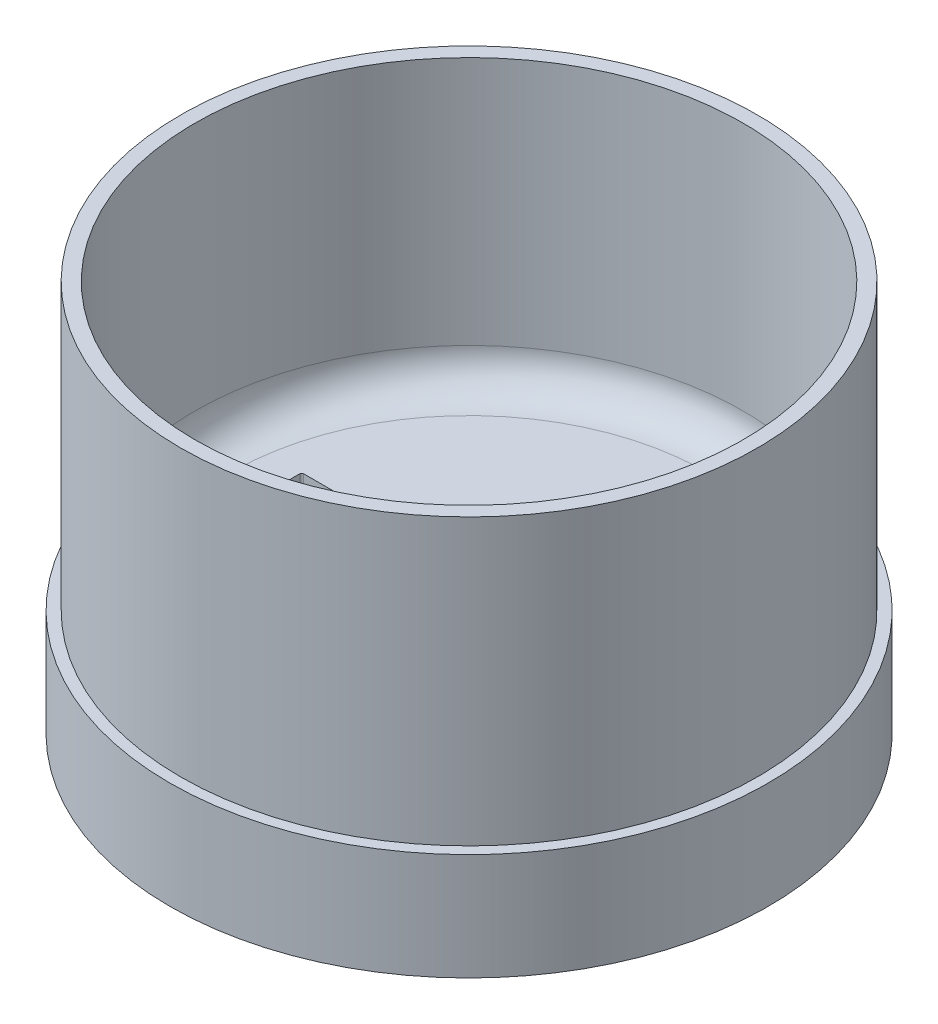
from build123d import *

# Parameters (mm, degrees)
SKETCH1_R           = 84
SKETCH1_R_2         = 79
BOSS_EXTRUDE1_DEPTH = 25
SKETCH2_R           = 84
BOSS_EXTRUDE2_DEPTH = 5
SKETCH3_R           = 81
SKETCH3_R_2         = 77
BOSS_EXTRUDE3_DEPTH = 80
FILLET1_R           = 10
CUT_EXTRUDE1_REACH  = 148.072
SKETCH4_W           = 14
SKETCH4_H           = 7
CUT_EXTRUDE2_REACH  = 145.22
SKETCH5_W           = 14
SKETCH5_H           = 20
FILLET2_R           = 1
FILLET3_R           = 0.5


with BuildPart() as part:
    # Sketch1 → Boss-Extrude1 (new body)
    with BuildSketch(Plane(origin=(0, 0, 0), x_dir=(1, 0, 0), z_dir=(0, 1, 0))):
        Circle(SKETCH1_R)
        Circle(SKETCH1_R_2, mode=Mode.SUBTRACT)
    extrude(amount=BOSS_EXTRUDE1_DEPTH)

    # Sketch2 → Boss-Extrude2 (add)
    with BuildSketch(Plane(origin=(0, 25, 0), x_dir=(1, 0, 0), z_dir=(0, 1, 0))):
        Circle(SKETCH2_R)
    extrude(amount=BOSS_EXTRUDE2_DEPTH)

    # Sketch3 → Boss-Extrude3 (add)
    with BuildSketch(Plane(origin=(0, 30, 0), x_dir=(1, 0, 0), z_dir=(0, 1, 0))):
        Circle(SKETCH3_R)
        Circle(SKETCH3_R_2, mode=Mode.SUBTRACT)
    extrude(amount=BOSS_EXTRUDE3_DEPTH)

    # Fillet1
    fillet1_edges = [part.edges().sort_by_distance(p)[0] for p in [
        (-79, 25, 0),
        (-77, 30, 0),
    ]]
    fillet(fillet1_edges, radius=FILLET1_R)

    # Sketch4 → Cut-Extrude1 (cut, up to next)
    with BuildSketch(Plane.XZ.offset(-25), mode=Mode.PRIVATE) as cut_extrude1_sk1:
        Rectangle(SKETCH4_W, SKETCH4_H)
    cut_extrude1_tool1 = extrude(cut_extrude1_sk1.sketch, amount=-CUT_EXTRUDE1_REACH, mode=Mode.PRIVATE) & part.part
    add(cut_extrude1_tool1.solids().sort_by_distance((0, 25, 0))[0], mode=Mode.SUBTRACT)

    # Sketch5 → Cut-Extrude2 (cut, up to next)
    with BuildSketch(Plane(origin=(0, 30, 0), x_dir=(1, 0, 0), z_dir=(0, 1, 0)), mode=Mode.PRIVATE) as cut_extrude2_sk1:
        with Locations((-50, 0)):
            Rectangle(SKETCH5_W, SKETCH5_H)
    cut_extrude2_tool1 = extrude(cut_extrude2_sk1.sketch, amount=-CUT_EXTRUDE2_REACH, mode=Mode.PRIVATE) & part.part
    add(cut_extrude2_tool1.solids().sort_by_distance((-50, 30, 0))[0], mode=Mode.SUBTRACT)

    # Fillet2
    fillet2_edges = [part.edges().sort_by_distance(p)[0] for p in [
        (-7, 25, 0),
        (0, 25, 3.5),
        (7, 25, 0),
        (0, 25, -3.5),
        (-7, 30, 0),
        (0, 30, 3.5),
        (7, 30, 0),
        (0, 30, -3.5),
    ]]
    fillet(fillet2_edges, radius=FILLET2_R)

    # Fillet3
    fillet3_edges = [part.edges().sort_by_distance(p)[0] for p in [
        (-43, 27.5, 10),
        (-57, 27.5, 10),
        (-43, 27.5, -10),
        (-57, 27.5, -10),
    ]]
    fillet(fillet3_edges, radius=FILLET3_R)


solid = part.part
